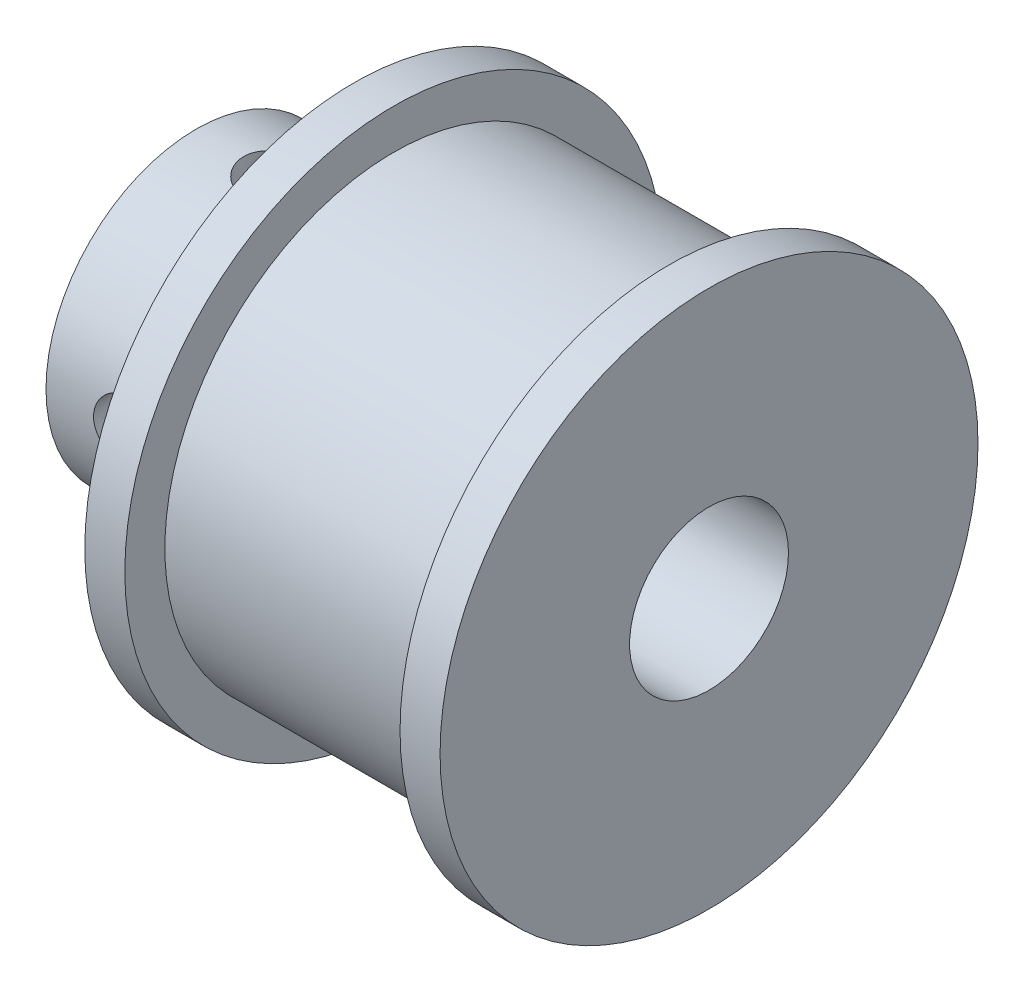
from build123d import *

# Parameters (mm, degrees)
SKETCH2_W = 1.25
SKETCH2_H = 10.75
SKETCH4_W = 1.25
SKETCH4_H = 10.75


with BuildPart() as part:
    # Sketch1 → Revolve1 (revolve)
    with BuildSketch(Plane.XY):
        Polygon((0, 3.175), (0, 6), (6.3, 6), (6.3, 10.75), (7.9, 10.75), (7.9, 9.15), (18.9, 9.15), (18.9, 10.75), (20.5, 10.75), (20.5, 3.175), align=None)
    revolve(axis=Axis((0, 0, 0), (-1, 0, 0)))

    # Sketch2 → M3x0.5 Tapped Hole1 (revolve, cut)
    with BuildSketch(Plane(origin=(3.15, 0, 0), x_dir=(0, 0, -1), z_dir=(1, 0, 0))):
        with Locations((0.625, 5.375)):
            Rectangle(SKETCH2_W, SKETCH2_H)
    revolve(axis=Axis((3.15, -6.35, 0), (0, 1, 0)), mode=Mode.SUBTRACT)

    # Sketch4 → M3x0.5 Tapped Hole2 (revolve, cut)
    with BuildSketch(Plane.YZ.offset(3.15)):
        with Locations((0.625, 5.375)):
            Rectangle(SKETCH4_W, SKETCH4_H)
    revolve(axis=Axis((3.15, 0, -6.35), (0, 0, 1)), mode=Mode.SUBTRACT)


solid = part.part
